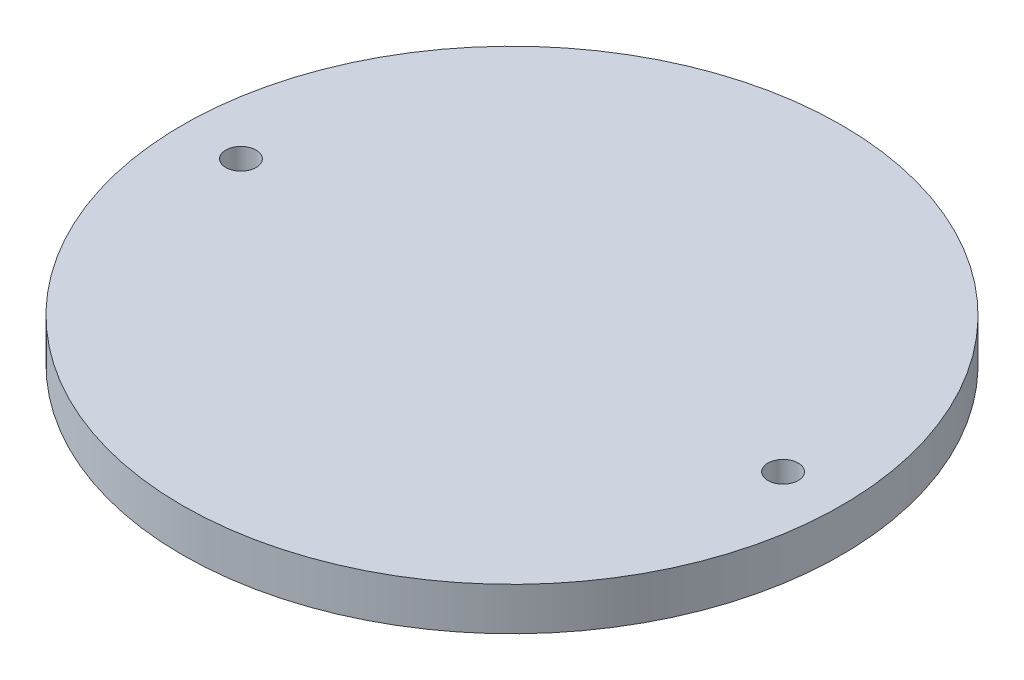
from build123d import *

# Parameters (mm, degrees)
SKETCH2_R               = 73.3425
BOSS_EXTRUDE1_DEPTH     = 9.525
F_1_4_CLEARANCE_HOLE1_D = 6.7564


with BuildPart() as part:
    # Sketch2 → Boss-Extrude1 (new body)
    with BuildSketch(Plane(origin=(0, 0, 0), x_dir=(1, 0, 0), z_dir=(0, 1, 0))):
        Circle(SKETCH2_R)
    extrude(amount=BOSS_EXTRUDE1_DEPTH)

    # 1/4 Clearance Hole1 (through all)
    with Locations(Plane(origin=(0, 9.525, 0), x_dir=(1, 0, 0), z_dir=(0, 1, 0))):
        with Locations((-60.325, 0), (60.325, 0)):
            Hole(F_1_4_CLEARANCE_HOLE1_D / 2)


solid = part.part
